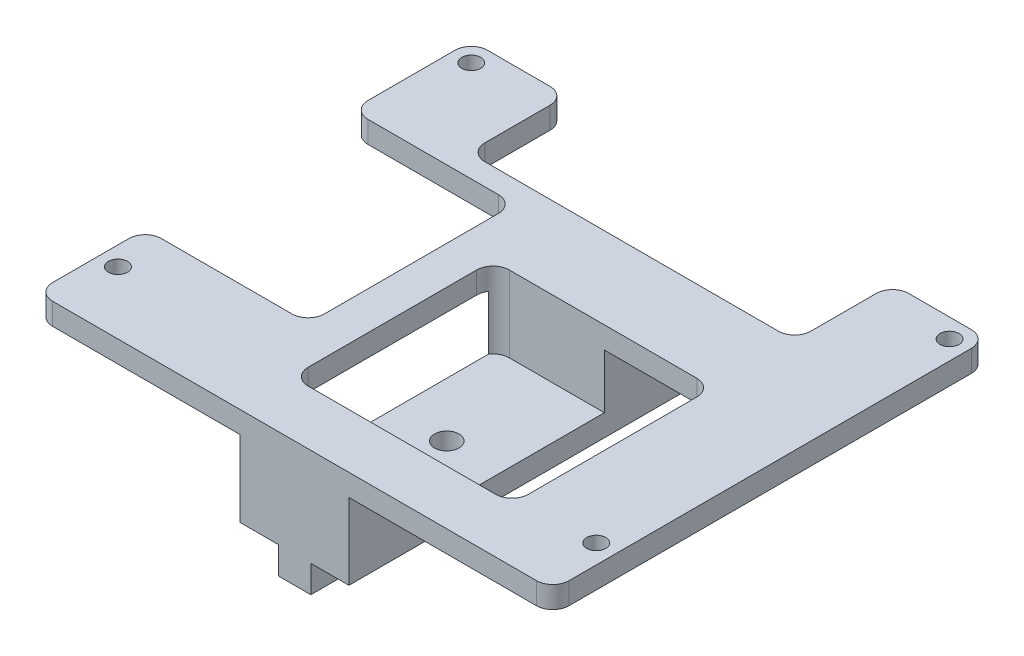
from build123d import *

# Parameters (mm, degrees)
SKETCH_1_W          = 60
SKETCH_1_H          = 37
SKETCH_1_R          = 1.75
EXTRUDE_1_DEPTH     = 4
SKETCH_2_W          = 20
SKETCH_2_H          = 10
SKETCH_2_H_2        = 15
EXTRUDE_2_DEPTH     = 10
SKETCH_3_W          = 20
SKETCH_3_H          = 62
EXTRUDE_3_DEPTH     = 4
SKETCH_4_W          = 6
SKETCH_4_H          = 15
EXTRUDE_4_DEPTH     = 5
CUT_EXTRUDE_1_REACH = 66.655
SKETCH_4_3_R        = 2.25
SKETCH_5_W          = 30
SKETCH_5_H          = 38
CUT_EXTRUDE_2_DEPTH = 67.221220164
EXTRUDE_7_DEPTH     = 4
FILLET_1_R          = 3


with BuildPart() as part:
    # 草图1 → 凸台-拉伸1 (new body)
    with BuildSketch(Plane(origin=(0, 0, 0), x_dir=(1, 0, 0), z_dir=(0, 1, 0))):
        Polygon((-30, 22), (-30, 40), (-47.5, 40), (-47.5, -40), (47.5, -40), (47.5, 40), (30, 40), (30, 22), align=None)
        with Locations((0, -11.5)):
            Rectangle(SKETCH_1_W, SKETCH_1_H, mode=Mode.SUBTRACT)
        with Locations(Location((-44, 36.5, 0), (0, 0, 270))):
            Circle(SKETCH_1_R, mode=Mode.SUBTRACT)
        with Locations(Location((44, 36.5, 0), (0, 0, 270))):
            Circle(SKETCH_1_R, mode=Mode.SUBTRACT)
        with Locations(Location((-44, -28.5, 0), (0, 0, 270))):
            Circle(SKETCH_1_R, mode=Mode.SUBTRACT)
        with Locations(Location((44, -28.5, 0), (0, 0, 270))):
            Circle(SKETCH_1_R, mode=Mode.SUBTRACT)
    extrude(amount=EXTRUDE_1_DEPTH)

    # 草图2 → 凸台-拉伸2 (add)
    with BuildSketch(Plane.XZ):
        with Locations((0, 35)):
            Rectangle(SKETCH_2_W, SKETCH_2_H)
        with Locations((0, -14.5)):
            Rectangle(SKETCH_2_W, SKETCH_2_H_2)
    extrude(amount=EXTRUDE_2_DEPTH)

    # 草图3 → 凸台-拉伸3 (add)
    with BuildSketch(Plane.XZ.offset(10)):
        with Locations((0, 9)):
            Rectangle(SKETCH_3_W, SKETCH_3_H)
    extrude(amount=EXTRUDE_3_DEPTH)

    # 草图4 → 凸台-拉伸4 (add)
    with BuildSketch(Plane.XZ.offset(14)):
        with Locations((0, 32.5)):
            Rectangle(SKETCH_4_W, SKETCH_4_H)
        with Locations((0, -14.5)):
            Rectangle(SKETCH_4_W, SKETCH_4_H)
    extrude(amount=EXTRUDE_4_DEPTH)

    # 草图4<3> → 切除-拉伸1 (cut, up to next)
    with BuildSketch(Plane.XZ.offset(14), mode=Mode.PRIVATE) as cut_extrude_1_sk1:
        with Locations(Location((0, 12, 0), (0, 0, 270))):
            Circle(SKETCH_4_3_R)
    cut_extrude_1_tool1 = extrude(cut_extrude_1_sk1.sketch, amount=-CUT_EXTRUDE_1_REACH, mode=Mode.PRIVATE) & part.part
    add(cut_extrude_1_tool1.solids().sort_by_distance((0, -14, 12))[0], mode=Mode.SUBTRACT)

    # 草图5 → 切除-拉伸2 (cut, through all)
    with BuildSketch(Plane(origin=(0, 4, 0), x_dir=(1, 0, 0), z_dir=(0, 1, 0))):
        with Locations((-32.5, -1)):
            Rectangle(SKETCH_5_W, SKETCH_5_H)
    extrude(amount=-CUT_EXTRUDE_2_DEPTH, mode=Mode.SUBTRACT)

    # 草图6 → 凸台-拉伸7 (add)
    with BuildSketch(Plane(origin=(0, 4, 0), x_dir=(1, 0, 0), z_dir=(0, 1, 0))):
        Polygon((-10.5, 7), (-17.5, 7), (-17.5, -20), (-30, -20), (-30, -30), (-10.5, -30), align=None)
    extrude(amount=-EXTRUDE_7_DEPTH)

    # 圆角1
    fillet_1_edges = [part.edges().sort_by_distance(p)[0] for p in [
        (-30, 2, -22),
    ]]
    fillet(fillet_1_edges, radius=FILLET_1_R)
    fillet_1_2_edges = [part.edges().sort_by_distance(p)[0] for p in [
        (-30, 2, -40),
    ]]
    fillet(fillet_1_2_edges, radius=FILLET_1_R)
    fillet_1_3_edges = [part.edges().sort_by_distance(p)[0] for p in [
        (30, 2, -7),
    ]]
    fillet(fillet_1_3_edges, radius=FILLET_1_R)
    fillet_1_4_edges = [part.edges().sort_by_distance(p)[0] for p in [
        (30, 2, 30),
    ]]
    fillet(fillet_1_4_edges, radius=FILLET_1_R)
    fillet_1_5_edges = [part.edges().sort_by_distance(p)[0] for p in [
        (-10.5, 2, 30),
    ]]
    fillet(fillet_1_5_edges, radius=FILLET_1_R)
    fillet_1_6_edges = [part.edges().sort_by_distance(p)[0] for p in [
        (30, 2, -40),
    ]]
    fillet(fillet_1_6_edges, radius=FILLET_1_R)
    fillet_1_7_edges = [part.edges().sort_by_distance(p)[0] for p in [
        (30, 2, -22),
    ]]
    fillet(fillet_1_7_edges, radius=FILLET_1_R)
    fillet_1_8_edges = [part.edges().sort_by_distance(p)[0] for p in [
        (47.5, 2, -40),
    ]]
    fillet(fillet_1_8_edges, radius=FILLET_1_R)
    fillet_1_9_edges = [part.edges().sort_by_distance(p)[0] for p in [
        (47.5, 2, 40),
    ]]
    fillet(fillet_1_9_edges, radius=FILLET_1_R)
    fillet_1_10_edges = [part.edges().sort_by_distance(p)[0] for p in [
        (-47.5, 2, 40),
    ]]
    fillet(fillet_1_10_edges, radius=FILLET_1_R)
    fillet_1_11_edges = [part.edges().sort_by_distance(p)[0] for p in [
        (-47.5, 2, 20),
    ]]
    fillet(fillet_1_11_edges, radius=FILLET_1_R)
    fillet_1_12_edges = [part.edges().sort_by_distance(p)[0] for p in [
        (-17.5, 2, 20),
    ]]
    fillet(fillet_1_12_edges, radius=FILLET_1_R)
    fillet_1_13_edges = [part.edges().sort_by_distance(p)[0] for p in [
        (-17.5, 2, -18),
    ]]
    fillet(fillet_1_13_edges, radius=FILLET_1_R)
    fillet_1_14_edges = [part.edges().sort_by_distance(p)[0] for p in [
        (-47.5, 2, -18),
    ]]
    fillet(fillet_1_14_edges, radius=FILLET_1_R)
    fillet_1_15_edges = [part.edges().sort_by_distance(p)[0] for p in [
        (-47.5, 2, -40),
    ]]
    fillet(fillet_1_15_edges, radius=FILLET_1_R)
    fillet_1_16_edges = [part.edges().sort_by_distance(p)[0] for p in [
        (-10.5, 2, -7),
    ]]
    fillet(fillet_1_16_edges, radius=FILLET_1_R)


solid = part.part
